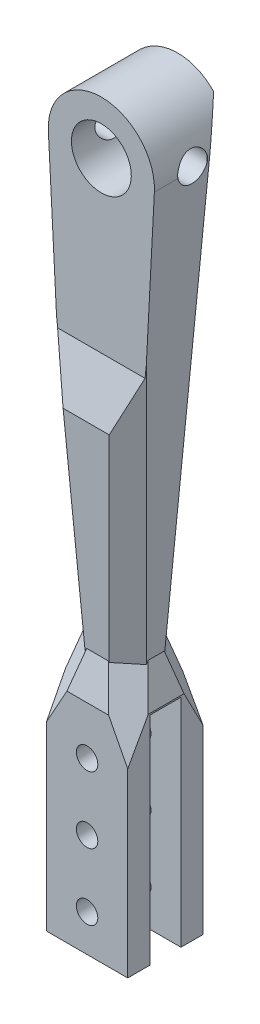
from build123d import *

# Parameters (mm, degrees)
SKETCH1_W                       = 11
SKETCH1_H                       = 29.5
BOSS_EXTRUDE1_DEPTH             = 10.2
CBORE_FOR_M2_5_SHCS1_AT_2_COUNT = 2
CBORE_FOR_M2_5_SHCS1_AT_2_PITCH = 9
CBORE_FOR_M2_5_SHCS1_AT_3_COUNT = 2
CBORE_FOR_M2_5_SHCS1_AT_3_PITCH = 18
CUT_EXTRUDE1_DEPTH              = 22.038120163
CUT_EXTRUDE1_DEPTH_BACK         = 22.038120163
SKETCH5_W                       = 4.2
SKETCH5_H                       = 29.3
SKETCH6_W                       = 11
SKETCH6_H                       = 10.2
BOSS_EXTRUDE2_DEPTH             = 5
BOSS_EXTRUDE2_TAPER             = 15
SKETCH7_W                       = 8.320508076
SKETCH7_H                       = 7.520508076
BOSS_EXTRUDE3_DEPTH             = 65
BOSS_EXTRUDE3_DRAFT             = -3
CHAMFER1_SIZE                   = 2.685958206
CHAMFER1_SIZE_2                 = 2.5
CHAMFER1_SIZE_3                 = 2.506875868
FILLET1_R                       = 7.180587
CUT_EXTRUDE2_DEPTH              = 87.566929667
CUT_EXTRUDE2_DEPTH_BACK         = 87.566929667
CUT_EXTRUDE4_DEPTH              = 86.67908162
CUT_EXTRUDE4_DEPTH_BACK         = 86.67908162
SKETCH13_R                      = 4.05
F_4_0MM_DOWEL_HOLE1_OUTLINE_W   = 2
F_4_0MM_DOWEL_HOLE1_OUTLINE_H   = 3.659209284


# Read off the part's stored shape, not the designer's step: Ø4.0mm Dowel Hole1
# Some blends are built 0.0001 mm under size
with BuildPart() as part:
    # Sketch1 → Boss-Extrude1 (new body)
    with BuildSketch(Plane.XY):
        Rectangle(SKETCH1_W, SKETCH1_H)
    extrude(amount=BOSS_EXTRUDE1_DEPTH)

    # Sketch4 → CBORE for M2.5 SHCS1 (revolve, cut)
    with BuildSketch(Plane(origin=(0, -9.75, 0), x_dir=(0, 1, 0), z_dir=(1, 0, 0))):
        Polygon((0, 0), (0, 10.2), (1.45, 10.2), (1.45, 2.5), (2.75, 2.5), (2.75, 0.025), (2.775, 0), align=None)
    cbore_for_m2_5_shcs1 = revolve(axis=Axis((0, -9.75, -6.35), (0, 0, 1)), mode=Mode.SUBTRACT)

    # CBORE for M2.5 SHCS1 at 2: CBORE for M2.5 SHCS1 ×2
    with Locations(*[(0, i * CBORE_FOR_M2_5_SHCS1_AT_2_PITCH, 0) for i in range(1, CBORE_FOR_M2_5_SHCS1_AT_2_COUNT)]):
        add(cbore_for_m2_5_shcs1, mode=Mode.SUBTRACT)

    # CBORE for M2.5 SHCS1 at 3: CBORE for M2.5 SHCS1 ×2
    with Locations(*[(0, i * CBORE_FOR_M2_5_SHCS1_AT_3_PITCH, 0) for i in range(1, CBORE_FOR_M2_5_SHCS1_AT_3_COUNT)]):
        add(cbore_for_m2_5_shcs1, mode=Mode.SUBTRACT)

    # Sketch5 → Cut-Extrude1 (cut, two sides: drawn at the far end of the back side and taken through both)
    with BuildSketch(Plane.ZY.offset(5.5).offset(-CUT_EXTRUDE1_DEPTH_BACK)):
        with Locations((5.1, -0.1)):
            Rectangle(SKETCH5_W, SKETCH5_H)
    extrude(amount=CUT_EXTRUDE1_DEPTH + CUT_EXTRUDE1_DEPTH_BACK, mode=Mode.SUBTRACT)

    # Sketch6 → Boss-Extrude2 (add)
    with BuildSketch(Plane(origin=(0, 14.75, 0), x_dir=(1, 0, 0), z_dir=(0, 1, 0))):
        with Locations((0, -5.1)):
            Rectangle(SKETCH6_W, SKETCH6_H)
    extrude(amount=BOSS_EXTRUDE2_DEPTH, taper=BOSS_EXTRUDE2_TAPER)


with BuildPart() as boss_extrude3_tool:
    # Sketch7 → Boss-Extrude3 (with draft: the straight prism first)
    with BuildSketch(Plane(origin=(0, 19.75, 0), x_dir=(1, 0, 0), z_dir=(0, 1, 0))):
        with Locations((0, -5.1)):
            Rectangle(SKETCH7_W, SKETCH7_H)
    extrude(amount=BOSS_EXTRUDE3_DEPTH)
    # Boss-Extrude3: the draft: its side faces are tilted about the plane it starts from
    boss_extrude3_sides = [boss_extrude3_tool.faces().sort_by_distance(p)[0] for p in [
        (4.160254038, 52.25, 5.1),
        (0, 52.25, 1.339745962),
        (-4.160254038, 52.25, 5.1),
        (0, 52.25, 8.860254038),
    ]]
    draft(boss_extrude3_sides, Plane(origin=(0, 19.75, 0), x_dir=(1, 0, 0), z_dir=(0, 1, 0)), BOSS_EXTRUDE3_DRAFT)


with BuildPart() as part_1:
    add(part.part)

    # Boss-Extrude3: add boss_extrude3_tool
    add(boss_extrude3_tool.part)

    # Chamfer1
    # the kernel refuses this chamfer: 2.685958206, 2.506875868, 2.5 mm, written as the material it takes off along each edge
    with BuildSketch(Plane(origin=(7.233738269, 8.279600693, 11.933738269), x_dir=(0.08950679865400309, -0.23533376139402715, -0.967784352912802), z_dir=(-0.25056280708573236, 0.9351131265310291, -0.25056280708573203))) as chamfer1_piece_1_section:
        Polygon((CHAMFER1_SIZE * 0.999673594955, CHAMFER1_SIZE * 0.0255480690476), (-CHAMFER1_SIZE_2 * 0.0924561168006, CHAMFER1_SIZE_2 * 0.995716760161), (0, 0), align=None)
    chamfer1_piece_1 = extrude(amount=19.185698612, mode=Mode.PRIVATE)
    chamfer1_piece_1 = split(chamfer1_piece_1, bisect_by=Plane(origin=(4.749112244, 14.607483703, 8.590746179), z_dir=(0, -0.05233595624294391, 0.9986295347545739)), keep=Keep.TOP, mode=Mode.PRIVATE)
    add(chamfer1_piece_1, mode=Mode.SUBTRACT)
    with BuildSketch(Plane(origin=(7.233738269, 8.279600693, 11.933738269), x_dir=(0.08950679865400309, -0.23533376139402715, -0.967784352912802), z_dir=(-0.25056280708573236, 0.9351131265310291, -0.25056280708573203))) as chamfer1_piece_2_section:
        Polygon((CHAMFER1_SIZE * 0.999673594955, CHAMFER1_SIZE * 0.0255480690476), (-CHAMFER1_SIZE_2 * 0.0924561168006, CHAMFER1_SIZE_2 * 0.995716760161), (0, 0), align=None)
    chamfer1_piece_2 = extrude(amount=19.185698612, mode=Mode.PRIVATE)
    chamfer1_piece_2 = split(chamfer1_piece_2, bisect_by=Plane(origin=(4.006118706, 16.808922673, 7.98117222), z_dir=(0.9986295347545739, -0.05233595624294391, 0)), keep=Keep.TOP, mode=Mode.PRIVATE)
    add(chamfer1_piece_2, mode=Mode.SUBTRACT)
    with BuildSketch(Plane(origin=(7.233738269, 8.279600693, -1.733738269), x_dir=(-0.967784352912802, -0.23533376139402723, -0.08950679865400304), z_dir=(-0.25056280708573203, 0.9351131265310291, 0.25056280708573203))) as chamfer1_piece_3_section:
        Polygon((CHAMFER1_SIZE * 0.999673594955, CHAMFER1_SIZE * 0.0255480690476), (-CHAMFER1_SIZE_2 * 0.0924561168006, CHAMFER1_SIZE_2 * 0.995716760161), (0, 0), align=None)
    chamfer1_piece_3 = extrude(amount=19.185698612, mode=Mode.PRIVATE)
    chamfer1_piece_3 = split(chamfer1_piece_3, bisect_by=Plane(origin=(3.890746179, 14.607483703, 0.750887756), z_dir=(0.9986295347545739, -0.05233595624294391, 0)), keep=Keep.TOP, mode=Mode.PRIVATE)
    add(chamfer1_piece_3, mode=Mode.SUBTRACT)
    with BuildSketch(Plane(origin=(7.233738269, 8.279600693, -1.733738269), x_dir=(-0.967784352912802, -0.23533376139402723, -0.08950679865400304), z_dir=(-0.25056280708573203, 0.9351131265310291, 0.25056280708573203))) as chamfer1_piece_4_section:
        Polygon((CHAMFER1_SIZE * 0.999673594955, CHAMFER1_SIZE * 0.0255480690476), (-CHAMFER1_SIZE_2 * 0.0924561168006, CHAMFER1_SIZE_2 * 0.995716760161), (0, 0), align=None)
    chamfer1_piece_4 = extrude(amount=19.185698612, mode=Mode.PRIVATE)
    chamfer1_piece_4 = split(chamfer1_piece_4, bisect_by=Plane(origin=(3.28117222, 16.808922673, 1.493881294), z_dir=(0, -0.05233595624294391, -0.9986295347545739)), keep=Keep.TOP, mode=Mode.PRIVATE)
    add(chamfer1_piece_4, mode=Mode.SUBTRACT)
    with BuildSketch(Plane(origin=(-7.233738269, 8.279600693, -1.733738269), x_dir=(0.9676796057430587, -0.2342901423618477, -0.09329689073610087), z_dir=(0.25056280708573236, 0.9351131265310291, 0.25056280708573203))) as chamfer1_piece_5_section:
        Polygon((CHAMFER1_SIZE_2 * 0.999565396144, -CHAMFER1_SIZE_2 * 0.0294791253514), (-CHAMFER1_SIZE * 0.0963710953578, -CHAMFER1_SIZE * 0.995345473824), (0, 0), align=None)
    chamfer1_piece_5 = extrude(amount=19.185698612, mode=Mode.PRIVATE)
    chamfer1_piece_5 = split(chamfer1_piece_5, bisect_by=Plane(origin=(-3.890770711, 14.607951798, 0.759844086), z_dir=(-0.9986295347545739, -0.05233595624294391, 0)), keep=Keep.TOP, mode=Mode.PRIVATE)
    add(chamfer1_piece_5, mode=Mode.SUBTRACT)
    with BuildSketch(Plane(origin=(-7.233738269, 8.279600693, -1.733738269), x_dir=(0.9676796057430587, -0.2342901423618477, -0.09329689073610087), z_dir=(0.25056280708573236, 0.9351131265310291, 0.25056280708573203))) as chamfer1_piece_6_section:
        Polygon((CHAMFER1_SIZE_2 * 0.999565396144, -CHAMFER1_SIZE_2 * 0.0294791253514), (-CHAMFER1_SIZE * 0.0963710953578, -CHAMFER1_SIZE * 0.995345473824), (0, 0), align=None)
    chamfer1_piece_6 = extrude(amount=19.185698612, mode=Mode.PRIVATE)
    chamfer1_piece_6 = split(chamfer1_piece_6, bisect_by=Plane(origin=(-3.341994856, 16.885507899, 1.489867632), z_dir=(0, -0.05233595624294391, -0.9986295347545739)), keep=Keep.TOP, mode=Mode.PRIVATE)
    add(chamfer1_piece_6, mode=Mode.SUBTRACT)
    with BuildSketch(Plane(origin=(-7.233738269, 8.279600693, 11.933738269), x_dir=(-0.09329689073610087, -0.2342901423618474, -0.9676796057430587), z_dir=(0.25056280708573203, 0.9351131265310291, -0.25056280708573203))) as chamfer1_piece_7_section:
        Polygon((CHAMFER1_SIZE_2 * 0.999565396144, -CHAMFER1_SIZE_2 * 0.0294791253514), (-CHAMFER1_SIZE * 0.0963710953578, -CHAMFER1_SIZE * 0.995345473824), (0, 0), align=None)
    chamfer1_piece_7 = extrude(amount=19.185698612, mode=Mode.PRIVATE)
    chamfer1_piece_7 = split(chamfer1_piece_7, bisect_by=Plane(origin=(-4.740155914, 14.607951798, 8.590770711), z_dir=(0, -0.05233595624294391, 0.9986295347545739)), keep=Keep.TOP, mode=Mode.PRIVATE)
    add(chamfer1_piece_7, mode=Mode.SUBTRACT)
    with BuildSketch(Plane(origin=(-7.233738269, 8.279600693, 11.933738269), x_dir=(-0.09329689073610087, -0.2342901423618474, -0.9676796057430587), z_dir=(0.25056280708573203, 0.9351131265310291, -0.25056280708573203))) as chamfer1_piece_8_section:
        Polygon((CHAMFER1_SIZE_2 * 0.999565396144, -CHAMFER1_SIZE_2 * 0.0294791253514), (-CHAMFER1_SIZE * 0.0963710953578, -CHAMFER1_SIZE * 0.995345473824), (0, 0), align=None)
    chamfer1_piece_8 = extrude(amount=19.185698612, mode=Mode.PRIVATE)
    chamfer1_piece_8 = split(chamfer1_piece_8, bisect_by=Plane(origin=(-4.010132368, 16.885507899, 8.041994856), z_dir=(-0.9986295347545739, -0.05233595624294391, 0)), keep=Keep.TOP, mode=Mode.PRIVATE)
    add(chamfer1_piece_8, mode=Mode.SUBTRACT)
    # the kernel refuses this chamfer: 2.685958206, 2.506875868, 2.5 mm, written as the material it takes off along each edge
    with BuildSketch(Plane(origin=(-3.604484305, 9.145281757, 8.304484305), x_dir=(0.998257838122397, 0.05073820775547923, 0.03011516064974776), z_dir=(-0.052264427688714005, 0.9972646886342373, 0.05226442768871396))) as chamfer1_2_piece_1_section:
        Polygon((CHAMFER1_SIZE_3 * 0.999624043446, CHAMFER1_SIZE_3 * 0.0274184562475), (-CHAMFER1_SIZE_2 * 0.0301563759466, CHAMFER1_SIZE_2 * 0.99954519307), (0, 0), align=None)
    chamfer1_2_piece_1 = extrude(amount=82.259449266, mode=Mode.PRIVATE)
    chamfer1_2_piece_1 = split(chamfer1_2_piece_1, bisect_by=Plane(origin=(4.065038814, 46.715563442, -0.016857923), z_dir=(-0.6371565255737595, 0.35415028175354435, 0.6845503194452988)), keep=Keep.TOP, mode=Mode.PRIVATE)
    add(chamfer1_2_piece_1, mode=Mode.SUBTRACT)
    with BuildSketch(Plane(origin=(7.903727343, 91.179725817, 12.603727343), x_dir=(-0.9982536933382549, 0.05073009352715152, 0.0302658445654427), z_dir=(-0.05226442768871403, -0.9972646886342373, -0.05226442768871396))) as chamfer1_2_piece_2_section:
        Polygon((CHAMFER1_SIZE_2 * 0.999619893, CHAMFER1_SIZE_2 * 0.0275693583223), (-CHAMFER1_SIZE_3 * 0.0303072660864, CHAMFER1_SIZE_3 * 0.999540629289), (0, 0), align=None)
    chamfer1_2_piece_2 = extrude(amount=82.259449266, mode=Mode.PRIVATE)
    chamfer1_2_piece_2 = split(chamfer1_2_piece_2, bisect_by=Plane(origin=(-4.73972724, 46.729717564, 0.651664322), z_dir=(0.6845503194452992, 0.35415028175354457, 0.6371565255737587)), keep=Keep.TOP, mode=Mode.PRIVATE)
    add(chamfer1_2_piece_2, mode=Mode.SUBTRACT)
    with BuildSketch(Plane(origin=(7.903727343, 91.179725817, -2.403727343), x_dir=(-0.998257838122397, 0.05073820775547923, -0.030115160649747844), z_dir=(-0.052264427688714005, -0.9972646886342373, 0.052264427688714005))) as chamfer1_2_piece_3_section:
        Polygon((CHAMFER1_SIZE_3 * 0.999624043446, -CHAMFER1_SIZE_3 * 0.0274184562475), (-CHAMFER1_SIZE_2 * 0.0301563759466, -CHAMFER1_SIZE_2 * 0.99954519307), (0, 0), align=None)
    chamfer1_2_piece_3 = extrude(amount=82.259449266, mode=Mode.PRIVATE)
    chamfer1_2_piece_3 = split(chamfer1_2_piece_3, bisect_by=Plane(origin=(-4.265855273, 47.413955288, 10.391255842), z_dir=(0.6371565255737592, 0.35415028175354435, -0.6845503194452989)), keep=Keep.TOP, mode=Mode.PRIVATE)
    add(chamfer1_2_piece_3, mode=Mode.SUBTRACT)
    with BuildSketch(Plane(origin=(-3.604484305, 9.145281757, 1.895515695), x_dir=(-0.030115160649747664, 0.05073820775547925, 0.998257838122397), z_dir=(-0.05226442768871402, 0.9972646886342373, -0.052264427688714025))) as chamfer1_2_piece_4_section:
        Polygon((CHAMFER1_SIZE_3 * 0.999624043446, CHAMFER1_SIZE_3 * 0.0274184562475), (-CHAMFER1_SIZE_2 * 0.0301563759466, CHAMFER1_SIZE_2 * 0.99954519307), (0, 0), align=None)
    chamfer1_2_piece_4 = extrude(amount=82.259449266, mode=Mode.PRIVATE)
    chamfer1_2_piece_4 = split(chamfer1_2_piece_4, bisect_by=Plane(origin=(-2.919667619, 22.551503967, 4.338501317), z_dir=(-0.6845503194452986, 0.35415028175354457, -0.6371565255737593)), keep=Keep.TOP, mode=Mode.PRIVATE)
    add(chamfer1_2_piece_4, mode=Mode.SUBTRACT)

    # Fillet1
    fillet1_edges = [part_1.edges().sort_by_distance(p)[0] for p in [
        (-7.566759691, 84.75, 5.103442639),
        (7.566759691, 84.75, 5.096557361),
    ]]
    fillet(fillet1_edges, radius=FILLET1_R - 0.0001)  # a hair under: the kernel refuses the full size

    # Sketch8 → Cut-Extrude2 (cut, two sides: drawn at the far end of the back side and taken through both)
    with BuildSketch(Plane(origin=(5.5, 0, 0), x_dir=(0, 0, -1), z_dir=(1, 0, 0)).offset(-CUT_EXTRUDE2_DEPTH_BACK)):
        Polygon((-8.266759691, 84.75), (-8.266759691, 54.75), (-10.328323266, 47.762429615), (-12.162595541, 82.762429615), (-12.266759691, 84.75), align=None)
    extrude(amount=CUT_EXTRUDE2_DEPTH + CUT_EXTRUDE2_DEPTH_BACK, mode=Mode.SUBTRACT)

    # Sketch13 → Cut-Extrude4 (cut, two sides: drawn at the far end of the back side and taken through both)
    with BuildSketch(Plane.XY.offset(8.266759691).offset(-CUT_EXTRUDE4_DEPTH_BACK)):
        with Locations(Location((0, 77.569413168, 0), (0, 0, 90))):
            Circle(SKETCH13_R)
    extrude(amount=CUT_EXTRUDE4_DEPTH + CUT_EXTRUDE4_DEPTH_BACK, mode=Mode.SUBTRACT)

    # Ø4.0mm Dowel Hole1 outline → Ø4.0mm Dowel Hole1 (revolve, cut)
    with BuildSketch(Plane(origin=(0, 77.569413168, 3.1), x_dir=(0, 1, 0), z_dir=(0, 0, -1))):
        with Locations((1, -5.351071492)):
            Rectangle(F_4_0MM_DOWEL_HOLE1_OUTLINE_W, F_4_0MM_DOWEL_HOLE1_OUTLINE_H)
        Polygon((0, 3.52146685), (2, 3.52146685), (2, 7.155586832), (2, 7.180612509), (0, 7.180612509), align=None)
        Polygon((2, 7.180612509), (2, 7.155586674), (2.025011882, 7.180598714), align=None)
    revolve(axis=Axis((0, 77.569413168, 3.1), (1, 0, 0)), mode=Mode.SUBTRACT)


solid = part_1.part
